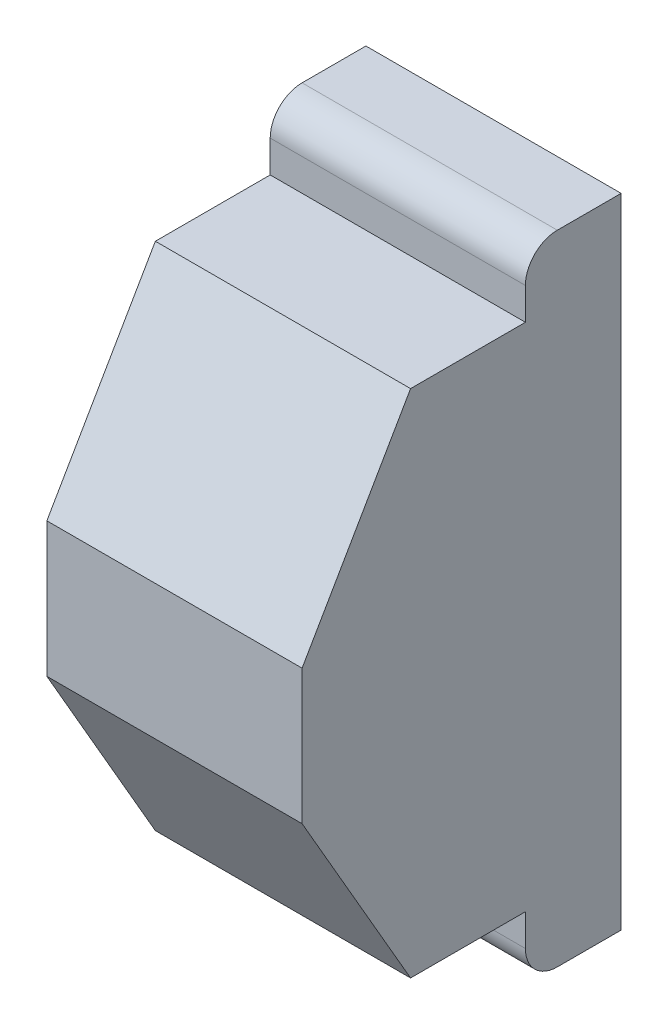
from build123d import *

# Parameters (mm, degrees)
BOSS_EXTRUDE1_DEPTH = 4
FILLET2_R           = 0.5


with BuildPart() as part:
    # Sketch1 → Boss-Extrude1 (new body)
    with BuildSketch(Plane(origin=(0, 0, 0), x_dir=(0, 0, -1), z_dir=(1, 0, 0))):
        Polygon((-0.8, 4), (-2.5, 1.055513627), (-2.5, -1.055513627), (-0.8, -4), (1, -4), (1, -5), (2.5, -5), (2.5, 5), (1, 5), (1, 4), align=None)
    extrude(amount=BOSS_EXTRUDE1_DEPTH)

    # Fillet2
    fillet2_edges = [part.edges().sort_by_distance(p)[0] for p in [
        (2, -5, -1),
        (2, 5, -1),
    ]]
    fillet(fillet2_edges, radius=FILLET2_R)


solid = part.part
